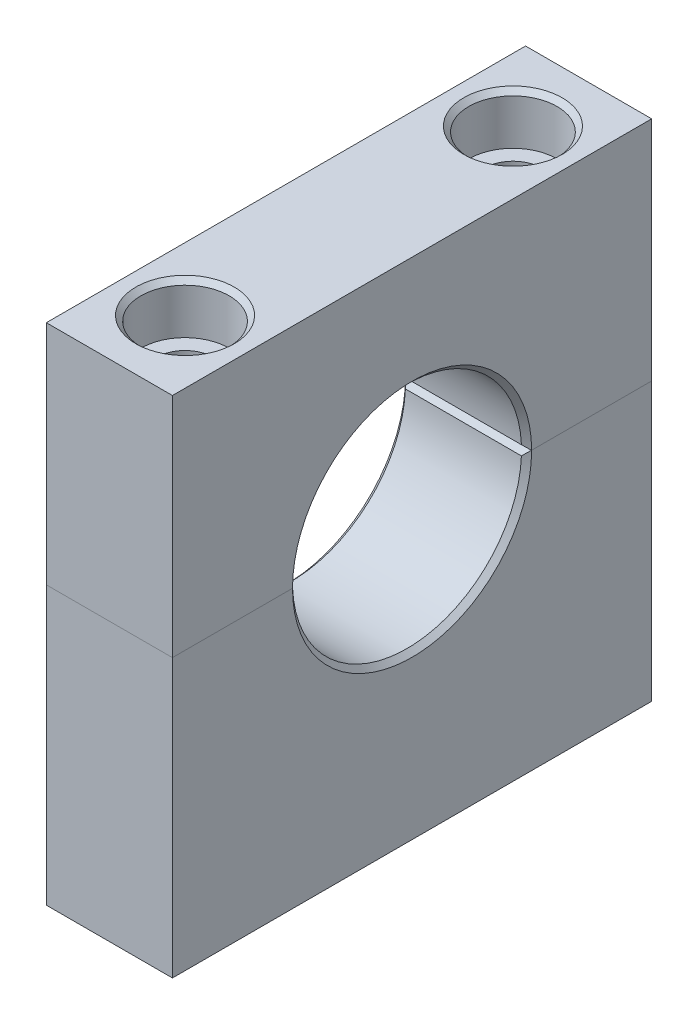
from build123d import *

# Parameters (mm, degrees)
BOSS_EXTRUDE1_DEPTH                           = 15.875
BOSS_EXTRUDE2_DEPTH                           = 15.875
CBORE_FOR_1_4_SOCKET_HEAD_CAP_SCREW1_AT_COUNT = 2
CBORE_FOR_1_4_SOCKET_HEAD_CAP_SCREW1_AT_PITCH = 41.275
MOVE_FACE1_BY                                 = 0.127
MOVE_FACE1_2_BY                               = 0.127
MOVE_START                                    = 28.575
MOVE_FACE2_OUTLINE_W                          = 15.875
MOVE_FACE2_OUTLINE_H                          = 60.325
MOVE_FACE2_OUTLINE_R                          = 5.55625
MOVE_FACE2_DEPTH                              = 6.35
MOVE_START_2                                  = 22.225
MOVE_FACE2_2_OUTLINE_R                        = 5.55625
MOVE_FACE2_2_OUTLINE_R_2                      = 3.57124
MOVE_FACE2_2_DEPTH                            = 6.35


with BuildPart() as part:
    # Sketch1 → Boss-Extrude1 (new body)
    with BuildSketch(Plane(origin=(0, 0, 0), x_dir=(0, 0, -1), z_dir=(1, 0, 0))):
        with BuildLine():
            Line((30.1625, 0), (14.2875, 0))
            ThreePointArc((14.2875, 0), (0, -14.2875), (-14.2875, 0))
            Line((-14.2875, 0), (-30.1625, 0))
            Line((-30.1625, 0), (-30.1625, -34.925))
            Line((-30.1625, -34.925), (30.1625, -34.925))
            Line((30.1625, -34.925), (30.1625, 0))
        make_face()
    extrude(amount=BOSS_EXTRUDE1_DEPTH)


with BuildPart() as body_2:
    # Sketch1<3> → Boss-Extrude2 (new body)
    with BuildSketch(Plane(origin=(0, 0, 0), x_dir=(0, 0, -1), z_dir=(1, 0, 0))):
        with BuildLine():
            ThreePointArc((-14.2875, 0), (0, 14.2875), (14.2875, 0))
            Line((14.2875, 0), (30.1625, 0))
            Line((30.1625, 0), (30.1625, 34.925))
            Line((30.1625, 34.925), (-30.1625, 34.925))
            Line((-30.1625, 34.925), (-30.1625, 0))
            Line((-30.1625, 0), (-14.2875, 0))
        make_face()
    extrude(amount=BOSS_EXTRUDE2_DEPTH)


with BuildPart() as cbore_for_1_4_socket_head_cap_screw1_tool:
    # Sketch4 → CBORE for 1/4 Socket Head Cap Screw1 (revolve)
    with BuildSketch(Plane(origin=(7.9375, 34.925, 20.6375), x_dir=(0, 0, 1), z_dir=(1, 0, 0))):
        Polygon((0, 0), (0, 69.85), (3.57124, 69.85), (3.57124, 6.35), (5.55625, 6.35), (5.55625, 0.635), (6.19125, 0), align=None)
    cbore_for_1_4_socket_head_cap_screw1 = revolve(axis=Axis((7.9375, 41.275, 20.6375), (0, -1, 0)))


with BuildPart() as part_1:
    add(part.part)

    # CBORE for 1/4 Socket Head Cap Screw1: cut by cbore_for_1_4_socket_head_cap_screw1_tool
    add(cbore_for_1_4_socket_head_cap_screw1_tool.part, mode=Mode.SUBTRACT)


with BuildPart() as body_2_1:
    add(body_2.part)

    # CBORE for 1/4 Socket Head Cap Screw1: cut by cbore_for_1_4_socket_head_cap_screw1_tool
    add(cbore_for_1_4_socket_head_cap_screw1_tool.part, mode=Mode.SUBTRACT)


with BuildPart() as cbore_for_1_4_socket_head_cap_screw1_at_tool:
    # CBORE for 1/4 Socket Head Cap Screw1 at: CBORE for 1/4 Socket Head Cap Screw1 ×2
    with Locations(*[(0, 0, -i * CBORE_FOR_1_4_SOCKET_HEAD_CAP_SCREW1_AT_PITCH) for i in range(1, CBORE_FOR_1_4_SOCKET_HEAD_CAP_SCREW1_AT_COUNT)]):
        add(cbore_for_1_4_socket_head_cap_screw1)


with BuildPart() as part_2:
    add(part_1.part)

    # CBORE for 1/4 Socket Head Cap Screw1 at: cut by cbore_for_1_4_socket_head_cap_screw1_at_tool
    add(cbore_for_1_4_socket_head_cap_screw1_at_tool.part, mode=Mode.SUBTRACT)

    # Move Face1 2: a curved face moved inward by 0.127
    add(Solid.thicken(part_2.faces().sort_by_distance((7.9375, -14.2875, 0))[0], -MOVE_FACE1_2_BY), mode=Mode.SUBTRACT)

    # Chamfer2
    # the kernel refuses this chamfer: 0.635 mm, written as the material it takes off along each edge
    with BuildSketch(Plane(origin=(0, 0, 0), x_dir=(0, 0.1132288377802066, -0.9935689358544497), z_dir=(0, 0.9935689358544497, 0.1132288377802066))) as chamfer2_piece_1:
        with BuildLine():
            Line((15.067460512, 0.017960512), (14.396539488, -0.652960512))
            Line((14.396539488, -0.652960512), (14.383839488, -0.652960512))
            ThreePointArc((14.383839488, -0.652960512), (14.4018, -0.326480256), (14.4018, 0))
            Line((14.4018, 0), (14.4145, 0.0127))
            ThreePointArc((14.4145, 0.0127), (14.740980256, 0.0127), (15.067460512, 0.030660512))
            Line((15.067460512, 0.030660512), (15.067460512, 0.017960512))
        make_face()
    revolve(axis=Axis((0, 0, 0), (-1, 0, 0)), revolution_arc=193.002955297, mode=Mode.SUBTRACT)
    with BuildSketch(Plane(origin=(-1.600435701, 0, -14.4145), x_dir=(0, 0, -1), z_dir=(1, 0, 0))) as chamfer2_piece_2:
        with BuildLine():
            Line((0.639932919, 0.017577515), (-0.031172593, -0.625784266))
            Line((-0.031172593, -0.625784266), (-0.043861283, -0.625248401))
            ThreePointArc((-0.043861283, -0.625248401), (-0.016099091, -0.31288099), (-0.0127, 0))
            Line((-0.0127, 0), (0, 0.0127))
            ThreePointArc((0, 0.0127), (0.319966459, 0.0127), (0.639932919, 0.030277515))
            Line((0.639932919, 0.030277515), (0.639932919, 0.017577515))
        make_face()
    extrude(amount=19.075871403, mode=Mode.SUBTRACT)
    with BuildSketch(Plane(origin=(-1.600435701, 0, 14.4145), x_dir=(0, -0.999777333387341, -0.021101745067597762), z_dir=(1, 0, 0))) as chamfer2_piece_3:
        with BuildLine():
            Line((0.626302721, 0.017960512), (-0.031077302, -0.639419511))
            Line((-0.031077302, -0.639419511), (-0.043774474, -0.639151519))
            ThreePointArc((-0.043774474, -0.639151519), (-0.019449023, -0.319627221), (-0.012697172, 0.000267992))
            Line((-0.012697172, 0.000267992), (0.000267992, 0.012697172))
            ThreePointArc((0.000267992, 0.012697172), (0.313151041, 0.009493172), (0.626034729, 0.030657684))
            Line((0.626034729, 0.030657684), (0.626302721, 0.017960512))
        make_face()
    extrude(amount=19.075871403, mode=Mode.SUBTRACT)
    with BuildSketch(Plane(origin=(15.875, 0, 0), x_dir=(0, 0.11322883778020662, -0.9935689358544497), z_dir=(0, 0.9935689358544497, 0.11322883778020662))) as chamfer2_piece_4:
        with BuildLine():
            Line((14.396539488, 0.652960512), (15.067460512, -0.017960512))
            Line((15.067460512, -0.017960512), (15.067460512, -0.030660512))
            ThreePointArc((15.067460512, -0.030660512), (14.740980256, -0.0127), (14.4145, -0.0127))
            Line((14.4145, -0.0127), (14.4018, 0))
            ThreePointArc((14.4018, 0), (14.4018, 0.326480256), (14.383839488, 0.652960512))
            Line((14.383839488, 0.652960512), (14.396539488, 0.652960512))
        make_face()
    revolve(axis=Axis((15.875, 0, 0), (-1, 0, 0)), revolution_arc=193.002955297, mode=Mode.SUBTRACT)


with BuildPart() as body_2_2:
    add(body_2_1.part)

    # CBORE for 1/4 Socket Head Cap Screw1 at: cut by cbore_for_1_4_socket_head_cap_screw1_at_tool
    add(cbore_for_1_4_socket_head_cap_screw1_at_tool.part, mode=Mode.SUBTRACT)

    # Move Face1: a curved face moved inward by 0.127
    add(Solid.thicken(body_2_2.faces().sort_by_distance((7.9375, 14.2875, 0))[0], -MOVE_FACE1_BY), mode=Mode.SUBTRACT)

    # Move Face2: read off the stored shape, not the designer's step
    # Move Face2 outline → Move Face2 (cut)
    with BuildSketch(Plane(origin=(0, 0, 0), x_dir=(1, 0, 0), z_dir=(0, 1, 0)).offset(MOVE_START)):
        with Locations((7.9375, 0)):
            Rectangle(MOVE_FACE2_OUTLINE_W, MOVE_FACE2_OUTLINE_H)
        with Locations((7.9375, -20.6375)):
            Circle(MOVE_FACE2_OUTLINE_R, mode=Mode.SUBTRACT)
        with Locations((7.9375, 20.6375)):
            Circle(MOVE_FACE2_OUTLINE_R, mode=Mode.SUBTRACT)
    extrude(amount=MOVE_FACE2_DEPTH, mode=Mode.SUBTRACT)

    # Move Face2 2 outline → Move Face2 2 (cut)
    # profile 1 of 2: a face of its own
    with BuildSketch(Plane(origin=(0, 0, 0), x_dir=(1, 0, 0), z_dir=(0, 1, 0)).offset(MOVE_START_2)):
        with Locations((7.9375, 20.6375)):
            Circle(MOVE_FACE2_2_OUTLINE_R)
        with Locations((7.9375, 20.6375)):
            Circle(MOVE_FACE2_2_OUTLINE_R_2, mode=Mode.SUBTRACT)
    # profile 2 of 2: a face of its own
    with BuildSketch(Plane(origin=(0, 0, 0), x_dir=(1, 0, 0), z_dir=(0, 1, 0)).offset(MOVE_START_2)):
        with Locations((7.9375, -20.6375)):
            Circle(MOVE_FACE2_2_OUTLINE_R)
        with Locations((7.9375, -20.6375)):
            Circle(MOVE_FACE2_2_OUTLINE_R_2, mode=Mode.SUBTRACT)
    extrude(amount=MOVE_FACE2_2_DEPTH, mode=Mode.SUBTRACT)

    # Move Face2 3: loft between two sections, ruled curve by curve
    move_face2_3_from = [
        Edge.make_three_point_arc((7.9375, 27.94, -15.08125), (13.49375, 27.94, -20.6375), (7.9375, 27.94, -26.19375)),
        Edge.make_three_point_arc((7.9375, 27.94, -26.19375), (2.38125, 27.94, -20.6375), (7.9375, 27.94, -15.08125)),
    ]
    move_face2_3_to = [
        Edge.make_three_point_arc((7.9375, 28.575, -14.44625), (14.12875, 28.575, -20.6375), (7.9375, 28.575, -26.82875)),
        Edge.make_three_point_arc((7.9375, 28.575, -26.82875), (1.74625, 28.575, -20.6375), (7.9375, 28.575, -14.44625)),
    ]
    move_face2_3 = Solid(Shell([*[Face.make_surface_from_curves(move_face2_3_from[k], move_face2_3_to[k]) for k in range(2)], Face(Wire(move_face2_3_from)), Face(Wire(move_face2_3_to))]))
    add(move_face2_3, mode=Mode.SUBTRACT)

    # Move Face2 4: loft between two sections, ruled curve by curve
    move_face2_4_from = [
        Edge.make_three_point_arc((7.9375, 27.94, 26.19375), (13.49375, 27.94, 20.6375), (7.9375, 27.94, 15.08125)),
        Edge.make_three_point_arc((7.9375, 27.94, 15.08125), (2.38125, 27.94, 20.6375), (7.9375, 27.94, 26.19375)),
    ]
    move_face2_4_to = [
        Edge.make_three_point_arc((7.9375, 28.575, 26.82875), (14.12875, 28.575, 20.6375), (7.9375, 28.575, 14.44625)),
        Edge.make_three_point_arc((7.9375, 28.575, 14.44625), (1.74625, 28.575, 20.6375), (7.9375, 28.575, 26.82875)),
    ]
    move_face2_4 = Solid(Shell([*[Face.make_surface_from_curves(move_face2_4_from[k], move_face2_4_to[k]) for k in range(2)], Face(Wire(move_face2_4_from)), Face(Wire(move_face2_4_to))]))
    add(move_face2_4, mode=Mode.SUBTRACT)

    # Chamfer1
    # the kernel refuses this chamfer: 0.635 mm, written as the material it takes off along each edge
    with BuildSketch(Plane(origin=(0, 0, 0), x_dir=(0, -0.11322883778020673, 0.9935689358544497), z_dir=(0, -0.9935689358544497, -0.11322883778020673))) as chamfer1_piece_1:
        with BuildLine():
            Line((15.067460512, 0.017960512), (14.396539488, -0.652960512))
            Line((14.396539488, -0.652960512), (14.383839488, -0.652960512))
            ThreePointArc((14.383839488, -0.652960512), (14.4018, -0.326480256), (14.4018, 0))
            Line((14.4018, 0), (14.4145, 0.0127))
            ThreePointArc((14.4145, 0.0127), (14.740980256, 0.0127), (15.067460512, 0.030660512))
            Line((15.067460512, 0.030660512), (15.067460512, 0.017960512))
        make_face()
    revolve(axis=Axis((0, 0, 0), (-1, 0, 0)), revolution_arc=193.002955297, mode=Mode.SUBTRACT)
    with BuildSketch(Plane(origin=(-1.600435701, 0, 14.4145), x_dir=(0, 0, 1), z_dir=(1, 0, 0))) as chamfer1_piece_2:
        with BuildLine():
            Line((0.639932919, 0.017577515), (-0.031172593, -0.625784266))
            Line((-0.031172593, -0.625784266), (-0.043861283, -0.625248401))
            ThreePointArc((-0.043861283, -0.625248401), (-0.016099091, -0.31288099), (-0.0127, 0))
            Line((-0.0127, 0), (0, 0.0127))
            ThreePointArc((0, 0.0127), (0.319966459, 0.0127), (0.639932919, 0.030277515))
            Line((0.639932919, 0.030277515), (0.639932919, 0.017577515))
        make_face()
    extrude(amount=19.075871403, mode=Mode.SUBTRACT)
    with BuildSketch(Plane(origin=(-1.600435701, 0, -14.4145), x_dir=(0, 0.999777333387341, 0.021101745067597762), z_dir=(1, 0, 0))) as chamfer1_piece_3:
        with BuildLine():
            Line((0.626302721, 0.017960512), (-0.031077302, -0.639419511))
            Line((-0.031077302, -0.639419511), (-0.043774474, -0.639151519))
            ThreePointArc((-0.043774474, -0.639151519), (-0.019449023, -0.319627221), (-0.012697172, 0.000267992))
            Line((-0.012697172, 0.000267992), (0.000267992, 0.012697172))
            ThreePointArc((0.000267992, 0.012697172), (0.313151041, 0.009493172), (0.626034729, 0.030657684))
            Line((0.626034729, 0.030657684), (0.626302721, 0.017960512))
        make_face()
    extrude(amount=19.075871403, mode=Mode.SUBTRACT)
    with BuildSketch(Plane(origin=(15.875, 0, 0), x_dir=(0, -0.11322883778020675, 0.9935689358544497), z_dir=(0, -0.9935689358544497, -0.11322883778020675))) as chamfer1_piece_4:
        with BuildLine():
            Line((14.396539488, 0.652960512), (15.067460512, -0.017960512))
            Line((15.067460512, -0.017960512), (15.067460512, -0.030660512))
            ThreePointArc((15.067460512, -0.030660512), (14.740980256, -0.0127), (14.4145, -0.0127))
            Line((14.4145, -0.0127), (14.4018, 0))
            ThreePointArc((14.4018, 0), (14.4018, 0.326480256), (14.383839488, 0.652960512))
            Line((14.383839488, 0.652960512), (14.396539488, 0.652960512))
        make_face()
    revolve(axis=Axis((15.875, 0, 0), (-1, 0, 0)), revolution_arc=193.002955297, mode=Mode.SUBTRACT)


solid = Compound([part_2.part, body_2_2.part])
